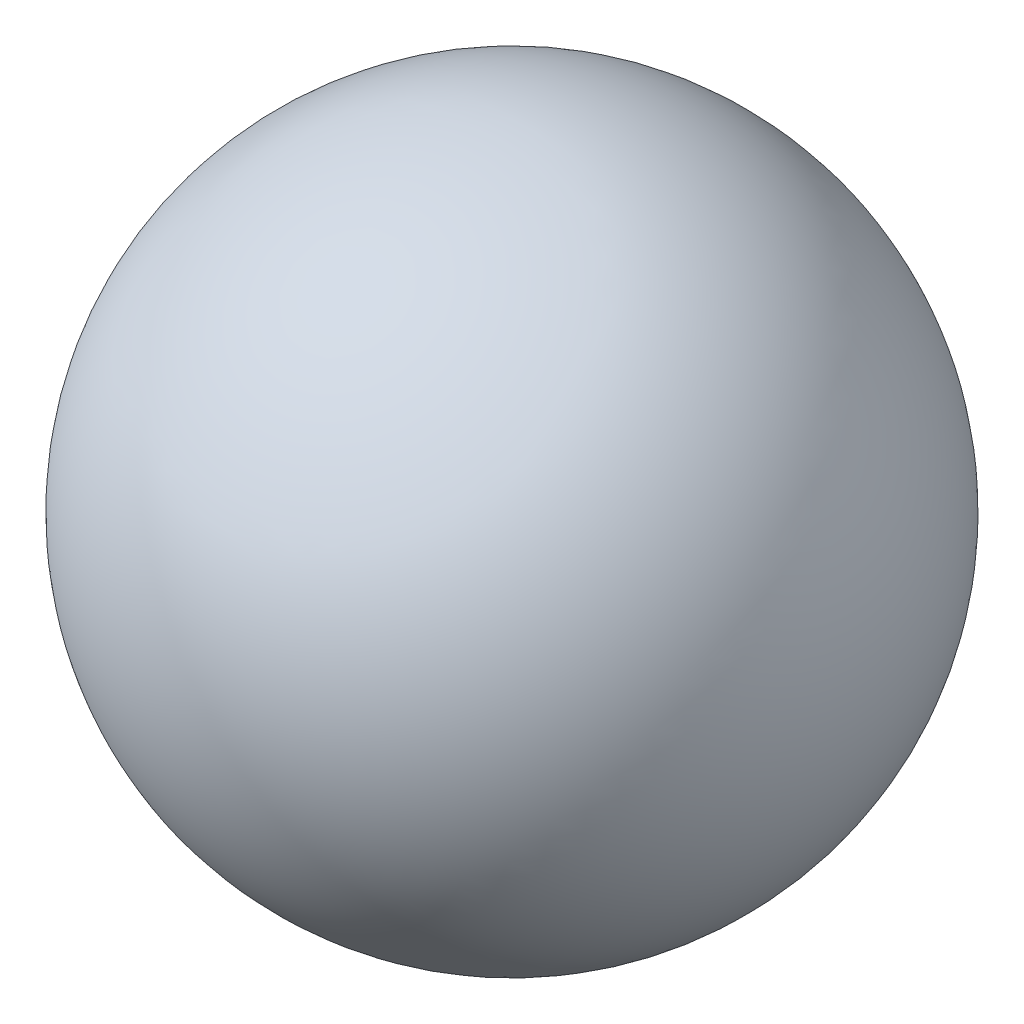
from build123d import *


with BuildPart() as part:
    # Sketch1 → Revolve4 (revolve)
    with BuildSketch(Plane(origin=(0, 0, 0), x_dir=(1, 0, 0), z_dir=(0, 1, 0))):
        with BuildLine():
            ThreePointArc((0, 10), (-10, 0), (0, -10))
            Line((0, -10), (0, 10))
        make_face()
    revolve(axis=Axis((0, 0, -10), (0, 0, 1)))


solid = part.part
